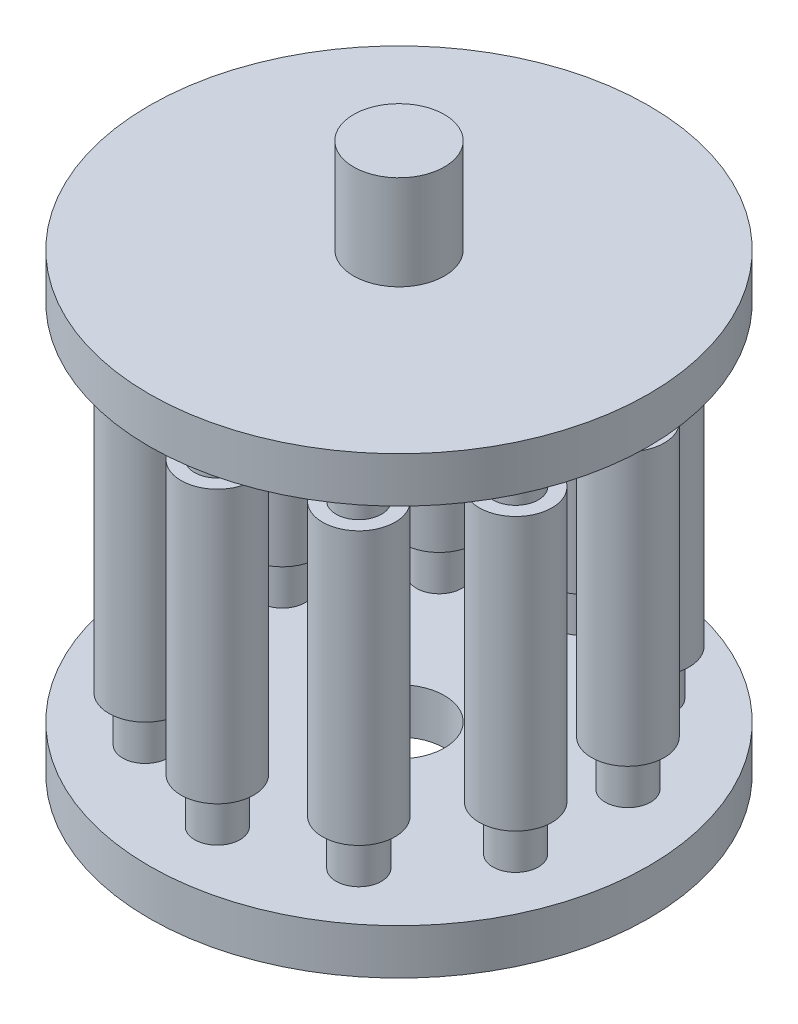
from build123d import *

# Parameters (mm, degrees)
STOCK_PART1_1_START       = -15
STOCK_PART1_1_OUTLINE_R   = 4
STOCK_PART1_1_DEPTH       = 30
STOCK_PART1_1_START_2     = -25
STOCK_PART1_1_2_OUTLINE_R = 27.5
STOCK_PART1_1_2_DEPTH     = 5
STOCK_PART1_1_START_3     = 20
STOCK_PART1_1_3_OUTLINE_R = 27.5
STOCK_PART1_1_3_DEPTH     = 5
STOCK_PART1_1_START_4     = -20
STOCK_PART1_1_4_OUTLINE_R = 2.5
STOCK_PART1_1_4_DEPTH     = 40
SKETCH1_R                 = 5
CUT_EXTRUDE1_DEPTH        = 10
SKETCH2_R                 = 5
BOSS_EXTRUDE1_DEPTH       = 10.4


# Read off the part's stored shape, not the designer's step: Stock-Part1-1
with BuildPart() as part:
    # Stock-Part1-1 outline → Stock-Part1-1 (new body)
    with BuildSketch(Plane(origin=(0, 0, 0), x_dir=(1, 0, 0), z_dir=(0, 1, 0)).offset(STOCK_PART1_1_START)):
        with Locations((-11.755705046, 16.180339887)):
            Circle(STOCK_PART1_1_OUTLINE_R)
        with Locations((0, 20)):
            Circle(STOCK_PART1_1_OUTLINE_R)
        with Locations((11.755705046, 16.180339887)):
            Circle(STOCK_PART1_1_OUTLINE_R)
        with Locations((19.021130326, 6.180339887)):
            Circle(STOCK_PART1_1_OUTLINE_R)
        with Locations((19.021130326, -6.180339887)):
            Circle(STOCK_PART1_1_OUTLINE_R)
        with Locations((11.755705046, -16.180339887)):
            Circle(STOCK_PART1_1_OUTLINE_R)
        with Locations((0, -20)):
            Circle(STOCK_PART1_1_OUTLINE_R)
        with Locations((-11.755705046, -16.180339887)):
            Circle(STOCK_PART1_1_OUTLINE_R)
        with Locations((-19.021130326, -6.180339887)):
            Circle(STOCK_PART1_1_OUTLINE_R)
        with Locations((-19.021130326, 6.180339887)):
            Circle(STOCK_PART1_1_OUTLINE_R)
    extrude(amount=STOCK_PART1_1_DEPTH)



with BuildPart() as body_2:
    # Stock-Part1-1 2 outline → Stock-Part1-1 2 (new body)
    with BuildSketch(Plane(origin=(0, 0, 0), x_dir=(1, 0, 0), z_dir=(0, 1, 0)).offset(STOCK_PART1_1_START_2)):
        Circle(STOCK_PART1_1_2_OUTLINE_R)
    extrude(amount=STOCK_PART1_1_2_DEPTH)


with BuildPart() as body_3:
    # Stock-Part1-1 3 outline → Stock-Part1-1 3 (new body)
    with BuildSketch(Plane(origin=(0, 0, 0), x_dir=(1, 0, 0), z_dir=(0, 1, 0)).offset(STOCK_PART1_1_START_3)):
        Circle(STOCK_PART1_1_3_OUTLINE_R)
    extrude(amount=STOCK_PART1_1_3_DEPTH)


with BuildPart() as part_1:
    add(part.part)

    add(body_2.part)  # Stock-Part1-1 4 merges body 2

    add(body_3.part)  # Stock-Part1-1 4 merges body 3
    # Stock-Part1-1 4 outline → Stock-Part1-1 4 (add)
    with BuildSketch(Plane(origin=(0, 0, 0), x_dir=(1, 0, 0), z_dir=(0, 1, 0)).offset(STOCK_PART1_1_START_4)):
        with Locations((-11.755705046, 16.180339887)):
            Circle(STOCK_PART1_1_4_OUTLINE_R)
        with Locations((0, 20)):
            Circle(STOCK_PART1_1_4_OUTLINE_R)
        with Locations((11.755705046, 16.180339888)):
            Circle(STOCK_PART1_1_4_OUTLINE_R)
        with Locations((19.021130326, 6.180339888)):
            Circle(STOCK_PART1_1_4_OUTLINE_R)
        with Locations((19.021130326, -6.180339887)):
            Circle(STOCK_PART1_1_4_OUTLINE_R)
        with Locations((11.755705046, -16.180339887)):
            Circle(STOCK_PART1_1_4_OUTLINE_R)
        with Locations((0, -20)):
            Circle(STOCK_PART1_1_4_OUTLINE_R)
        with Locations((-11.755705046, -16.180339888)):
            Circle(STOCK_PART1_1_4_OUTLINE_R)
        with Locations((-19.021130326, -6.180339888)):
            Circle(STOCK_PART1_1_4_OUTLINE_R)
        with Locations((-19.021130326, 6.180339887)):
            Circle(STOCK_PART1_1_4_OUTLINE_R)
    extrude(amount=STOCK_PART1_1_4_DEPTH)

    # Sketch1 → Cut-Extrude1 (cut)
    with BuildSketch(Plane.XZ.offset(25)):
        with Locations(Location((0, 0, 0), (0, 0, 270))):
            Circle(SKETCH1_R)
    extrude(amount=-CUT_EXTRUDE1_DEPTH, mode=Mode.SUBTRACT)

    # Sketch2 → Boss-Extrude1 (add)
    with BuildSketch(Plane(origin=(0, 25, 0), x_dir=(1, 0, 0), z_dir=(0, 1, 0))):
        with Locations(Location((0, 0, 0), (0, 0, 90))):
            Circle(SKETCH2_R)
    extrude(amount=BOSS_EXTRUDE1_DEPTH)


solid = part_1.part
